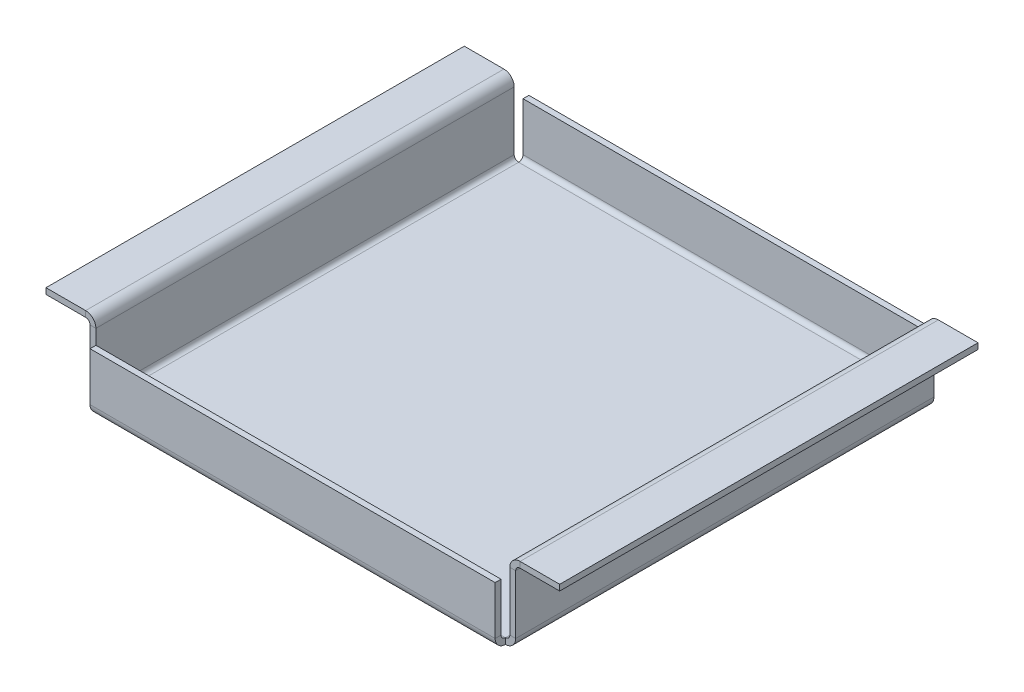
from build123d import *

# Parameters (mm, degrees)
BASE_FLANGIA1_DEPTH       = 142.5
BORDO_FLANGIA1_DEPTH      = 276
BORDO_FLANGIA1_BEND_DEPTH = 276


# Sheet-metal steps are written as plain solids
with BuildPart() as part:
    # Schizzo1 → Base-Flangia1 (new, symmetric)
    with BuildSketch(Plane.XY):
        with BuildLine():
            Line((-175, 50), (-148, 50))
            ThreePointArc((-148, 50), (-145.878679656, 49.121320344), (-145, 47))
            Line((-145, 47), (-145, 7))
            ThreePointArc((-145, 7), (-142.949747468, 2.050252532), (-138, 0))
            Line((-138, 0), (138, 0))
            ThreePointArc((138, 0), (142.949747468, 2.050252532), (145, 7))
            Line((145, 7), (145, 47))
            ThreePointArc((145, 47), (145.878679656, 49.121320344), (148, 50))
            Line((148, 50), (175, 50))
            Line((175, 50), (175, 54))
            Line((175, 54), (148, 54))
            ThreePointArc((148, 54), (143.050252532, 51.949747468), (141, 47))
            Line((141, 47), (141, 7))
            ThreePointArc((141, 7), (140.121320344, 4.878679656), (138, 4))
            Line((138, 4), (-138, 4))
            ThreePointArc((-138, 4), (-140.121320344, 4.878679656), (-141, 7))
            Line((-141, 7), (-141, 47))
            ThreePointArc((-141, 47), (-143.050252532, 51.949747468), (-148, 54))
            Line((-148, 54), (-175, 54))
            Line((-175, 54), (-175, 50))
        make_face()
    extrude(amount=BASE_FLANGIA1_DEPTH, both=True)

    # Bordo-Flangia1 section (across the edge) → Bordo-Flangia1 (add)
    with BuildSketch(Plane(origin=(-138, 4, 145.5), x_dir=(0, 0, -1), z_dir=(1, 0, 0))):
        with BuildLine():
            Line((-4, 3), (-4, 36))
            Line((-4, 36), (0, 36))
            Line((0, 36), (0, 3))
            ThreePointArc((0, 3), (0.878679656, 0.878679656), (3, 0))
            Line((3, 0), (3, -4))
            ThreePointArc((3, -4), (-1.949747468, -1.949747468), (-4, 3))
        make_face()
    extrude(amount=BORDO_FLANGIA1_DEPTH)

    # Bordo-Flangia1 section 2 (across the edge) → Bordo-Flangia1 bend (add)
    with BuildSketch(Plane(origin=(138, 4, -145.5), x_dir=(0, 0, 1), z_dir=(-1, 0, 0))):
        with BuildLine():
            Line((-4, 3), (-4, 36))
            Line((-4, 36), (0, 36))
            Line((0, 36), (0, 3))
            ThreePointArc((0, 3), (0.878679656, 0.878679656), (3, 0))
            Line((3, 0), (3, -4))
            ThreePointArc((3, -4), (-1.949747468, -1.949747468), (-4, 3))
        make_face()
    extrude(amount=BORDO_FLANGIA1_BEND_DEPTH)


solid = part.part
